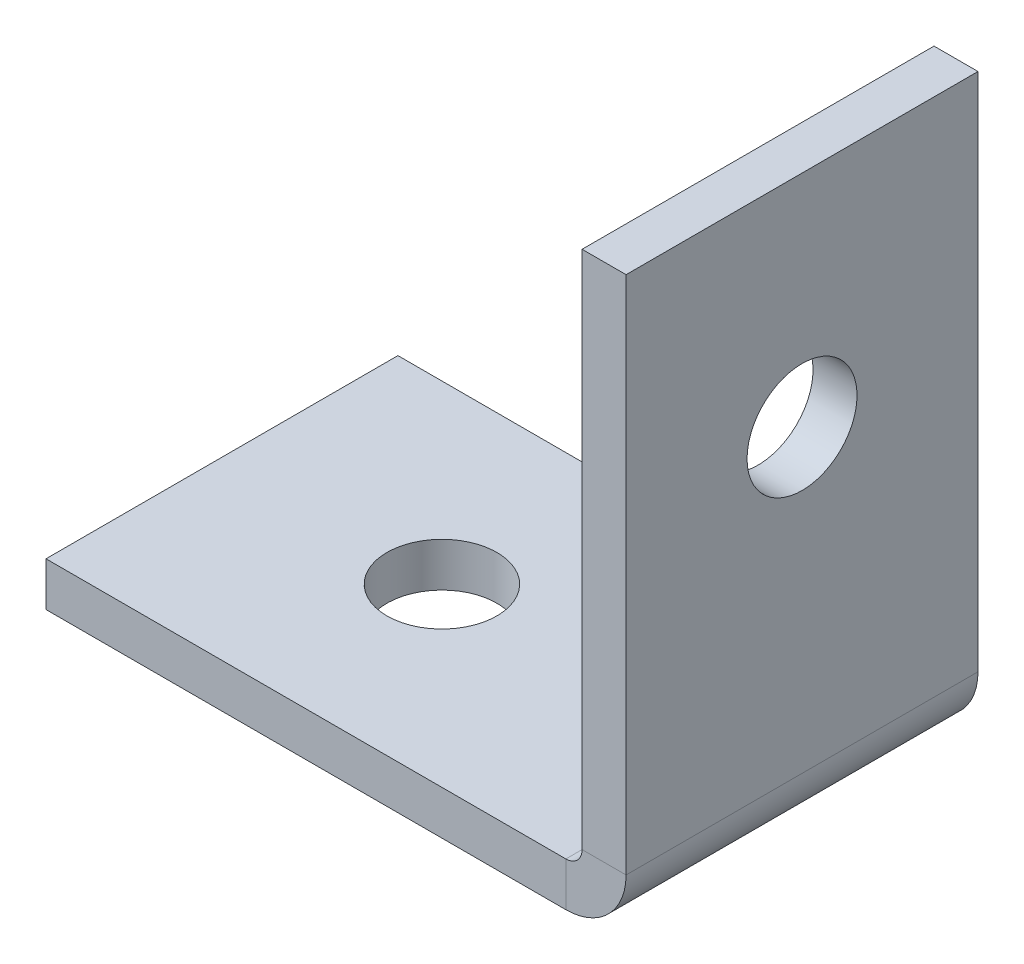
from build123d import *

# Parameters (mm, degrees)
CROQUIS2_W                      = 50
CROQUIS2_H                      = 16
CROQUIS2_R                      = 2.5
BRIDA_BASE1_DEPTH               = 2
PLIEGUE_START                   = -8
PLIEGUE_CROQUIZADO1_DEPTH       = 16
PLIEGUE_CROQUIZADO1_2_DEPTH     = 5.4999999
PLIEGUE_START_2                 = 2.5000001
PLIEGUE_CROQUIZADO1_3_DEPTH     = 5.4999999
PLIEGUE_START_3                 = -2.5000001
PLIEGUE_CROQUIZADO1_4_DEPTH     = 5.0000002
PLIEGUE_START_4                 = -0.627322451
PLIEGUE_CROQUIZADO1_5_OUTLINE_R = 2.5
PLIEGUE_CROQUIZADO1_5_DEPTH     = 2


with BuildPart() as part:
    # Brida base1: sheet metal written as solids
    # Croquis2 → Brida base1 (new body)
    with BuildSketch(Plane(origin=(0, 0, 0), x_dir=(1, 0, 0), z_dir=(0, 1, 0))):
        Rectangle(CROQUIS2_W, CROQUIS2_H)
        with Locations(Location((15, 0, 0), (0, 0, 270))):
            Circle(CROQUIS2_R, mode=Mode.SUBTRACT)
        with Locations(Location((-15, 0, 0), (0, 0, 270))):
            Circle(CROQUIS2_R, mode=Mode.SUBTRACT)
    extrude(amount=-BRIDA_BASE1_DEPTH)

    # Pliegue croquizado1: read off the stored shape, not the designer's step
    # Pliegue croquizado1 outline → Pliegue croquizado1 (cut)
    with BuildSketch(Plane.XY.offset(PLIEGUE_START)):
        with BuildLine():
            Line((25, 0), (1.271679947, 0))
            ThreePointArc((1.271679947, 0), (0.290344758, -1.443395312), (-1.363922451, -2))
            Line((-1.363922451, -2), (25, -2))
            Line((25, -2), (25, 0))
        make_face()
    extrude(amount=PLIEGUE_CROQUIZADO1_DEPTH, mode=Mode.SUBTRACT)

    # Pliegue croquizado1 2 outline → Pliegue croquizado1 2 (add)
    with BuildSketch(Plane.XY.offset(PLIEGUE_START)):
        with BuildLine():
            Line((-0.627322451, 24.372677549), (-0.627322451, 0.7366))
            ThreePointArc((-0.627322451, 0.7366), (-0.843067596, 0.215745145), (-1.363922451, 0))
            Line((-1.363922451, 0), (1.271679947, 0))
            ThreePointArc((1.271679947, 0), (1.347310579, 0.364854094), (1.372677549, 0.7366))
            Line((1.372677549, 0.7366), (1.372677549, 24.372677549))
            Line((1.372677549, 24.372677549), (-0.627322451, 24.372677549))
        make_face()
    extrude(amount=PLIEGUE_CROQUIZADO1_2_DEPTH)

    # Pliegue croquizado1 3 outline → Pliegue croquizado1 3 (add)
    with BuildSketch(Plane.XY.offset(PLIEGUE_START_2)):
        with BuildLine():
            Line((-0.627322451, 24.372677549), (-0.627322451, 0.7366))
            ThreePointArc((-0.627322451, 0.7366), (-0.843067596, 0.215745145), (-1.363922451, 0))
            Line((-1.363922451, 0), (1.271679947, 0))
            ThreePointArc((1.271679947, 0), (1.347310579, 0.364854094), (1.372677549, 0.7366))
            Line((1.372677549, 0.7366), (1.372677549, 24.372677549))
            Line((1.372677549, 24.372677549), (-0.627322451, 24.372677549))
        make_face()
    extrude(amount=PLIEGUE_CROQUIZADO1_3_DEPTH)

    # Pliegue croquizado1 4 outline → Pliegue croquizado1 4 (add)
    with BuildSketch(Plane.XY.offset(PLIEGUE_START_3)):
        with BuildLine():
            Line((-0.627322451, 24.372677549), (-0.627322451, 0.7366))
            ThreePointArc((-0.627322451, 0.7366), (-0.843067596, 0.215745145), (-1.363922451, 0))
            Line((-1.363922451, 0), (1.271679947, 0))
            ThreePointArc((1.271679947, 0), (1.347310579, 0.364854094), (1.372677549, 0.7366))
            Line((1.372677549, 0.7366), (1.372677549, 24.372677549))
            Line((1.372677549, 24.372677549), (-0.627322451, 24.372677549))
        make_face()
    extrude(amount=PLIEGUE_CROQUIZADO1_4_DEPTH)

    # Pliegue croquizado1 5 outline → Pliegue croquizado1 5 (cut)
    with BuildSketch(Plane.YZ.offset(PLIEGUE_START_4)):
        with Locations((14.372677549, 0)):
            Circle(PLIEGUE_CROQUIZADO1_5_OUTLINE_R)
    extrude(amount=PLIEGUE_CROQUIZADO1_5_DEPTH, mode=Mode.SUBTRACT)


solid = part.part
